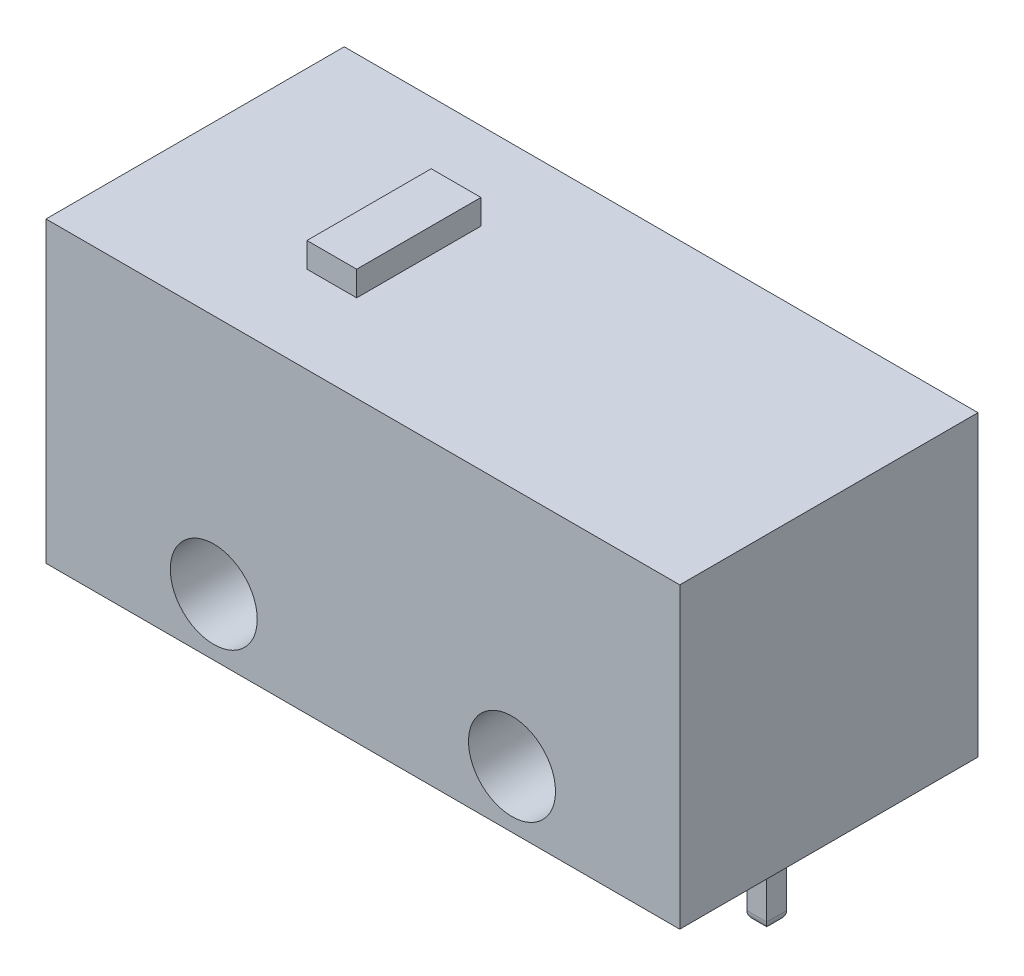
from build123d import *

# Parameters (mm, degrees)
SKETCH1_W             = 12.75
SKETCH1_H             = 6
BOSS_EXTRUDE1_DEPTH   = 6
F_1_0MM_DOWEL_HOLE1_D = 1.75
SKETCH4_W             = 1
SKETCH4_H             = 2.5
BOSS_EXTRUDE2_DEPTH   = 0.5
SKETCH7_W             = 0.4
SKETCH7_H             = 0.4
EXTRUDE_THIN6_DEPTH   = 2
FILLET9_R             = 0.2


with BuildPart() as part:
    # Sketch1 → Boss-Extrude1 (new body)
    with BuildSketch(Plane.XY):
        with Locations((6.375, 3)):
            Rectangle(SKETCH1_W, SKETCH1_H)
    extrude(amount=BOSS_EXTRUDE1_DEPTH)

    # Ø1.0mm Dowel Hole1 (through all)
    with Locations(Plane.XY.offset(6)):
        with Locations((3.375, 1.15), (9.375, 1.15)):
            Hole(F_1_0MM_DOWEL_HOLE1_D / 2)

    # Sketch4 → Boss-Extrude2 (add)
    with BuildSketch(Plane(origin=(0, 6, 0), x_dir=(1, 0, 0), z_dir=(0, 1, 0))):
        with Locations((4, -3)):
            Rectangle(SKETCH4_W, SKETCH4_H)
    extrude(amount=BOSS_EXTRUDE2_DEPTH)

    # Sketch7 → Extrude-Thin6 (add)
    with BuildSketch(Plane.XZ):
        with Locations((11.5, 3)):
            Rectangle(SKETCH7_W, SKETCH7_H)
        with Locations((6.375, 3)):
            Rectangle(SKETCH7_W, SKETCH7_H)
        with Locations((1.25, 3)):
            Rectangle(SKETCH7_W, SKETCH7_H)
    extrude(amount=EXTRUDE_THIN6_DEPTH)

    # Fillet9
    fillet9_edges = [part.edges().sort_by_distance(p)[0] for p in [
        (6.575, -2, 3),
        (6.375, -2, 3.2),
        (6.175, -2, 3),
        (6.375, -2, 2.8),
        (1.45, -2, 3),
        (1.25, -2, 3.2),
        (1.05, -2, 3),
        (1.25, -2, 2.8),
        (11.3, -2, 3),
        (11.5, -2, 2.8),
        (11.7, -2, 3),
        (11.5, -2, 3.2),
    ]]
    fillet(fillet9_edges, radius=FILLET9_R - 0.0001)  # a hair under: the kernel refuses the full size


solid = part.part
